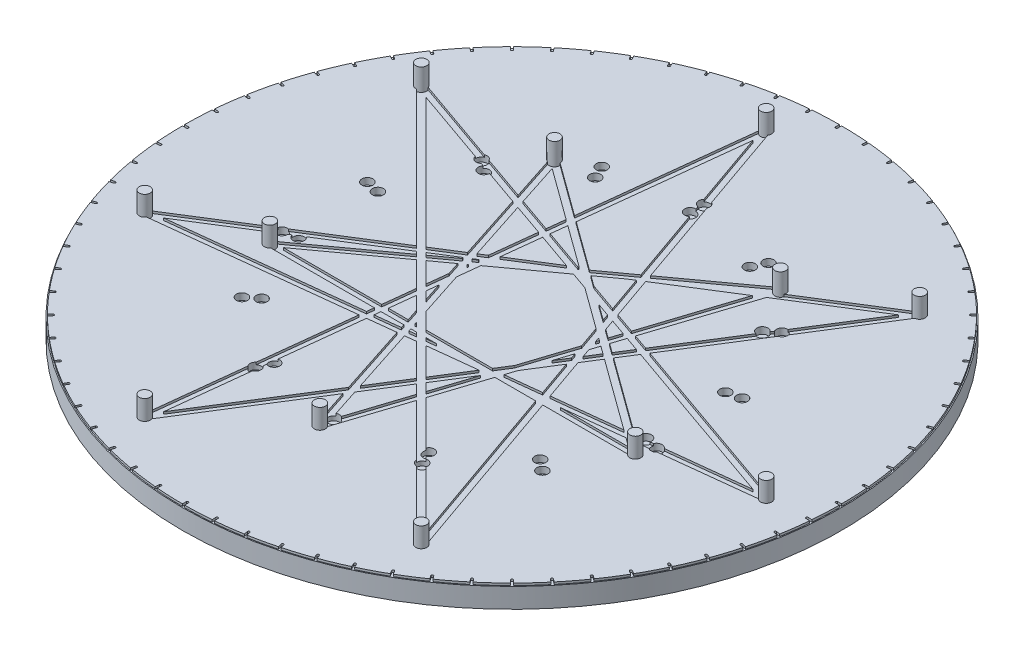
from build123d import *

# Parameters (mm, degrees)
SKETCH1_W              = 300
SKETCH1_H              = 300
BOSS_EXTRUDE2_DEPTH    = 10
CUT_EXTRUDE2_DEPTH     = 1
CUT_EXTRUDE3_START     = -1
CUT_EXTRUDE3_DEPTH     = 1
SKETCH5_R              = 2.5
SKETCH5_R_2            = 2.500000001
BOSS_EXTRUDE3_DEPTH    = 10
SKETCH9_R              = 1.885387977
CUT_EXTRUDE4_DEPTH     = 1
CUT_EXTRUDE5_START     = -1
CUT_EXTRUDE5_OUTLINE_R = 149.65385122
CUT_EXTRUDE5_DEPTH     = 1
CUT_EXTRUDE6_START     = -10
SKETCH11_W             = 362.877518505
SKETCH11_H             = 323.421313856
SKETCH11_R             = 149.65385122
CUT_EXTRUDE6_DEPTH     = 10
SKETCH12_R             = 2.500000001
SKETCH12_R_2           = 2.5
CUT_EXTRUDE7_DEPTH     = 3


# Read off the part's stored shape, not the designer's step: Cut-Extrude3, Cut-Extrude5
with BuildPart() as part:
    # Sketch1 → Boss-Extrude2 (new body)
    with BuildSketch(Plane(origin=(0, 0, 0), x_dir=(1, 0, 0), z_dir=(0, 1, 0))):
        Rectangle(SKETCH1_W, SKETCH1_H)
    extrude(amount=-BOSS_EXTRUDE2_DEPTH)

    # Sketch4 → Cut-Extrude2 (cut)
    with BuildSketch(Plane(origin=(0, 0, 0), x_dir=(1, 0, 0), z_dir=(0, 1, 0))):
        with BuildLine():
            Line((-2.044618763, -85.826412458), (-20.68202698, -28.466368014))
            Line((-20.68202698, -28.466368014), (-80.993946895, -28.466368014))
            ThreePointArc((-80.993946895, -28.466368014), (-85.371588185, -27.7389105), (-82.257590784, -24.577272018))
            Line((-82.257590784, -24.577272018), (-33.464222611, 10.873185046))
            Line((-33.464222611, 10.873185046), (-52.101630828, 68.233229491))
            ThreePointArc((-52.101630828, 68.233229491), (-52.762543171, 72.621410501), (-48.793368173, 70.636823003))
            Line((-48.793368173, 70.636823003), (0, 35.186365939))
            Line((0, 35.186365939), (48.793368175, 70.636823002))
            ThreePointArc((48.793368175, 70.636823002), (52.762543172, 72.6214105), (52.101630827, 68.23322949))
            Line((52.101630827, 68.23322949), (33.464222609, 10.873185045))
            Line((33.464222609, 10.873185045), (82.257590783, -24.577272019))
            ThreePointArc((82.257590783, -24.577272019), (85.371588185, -27.738910499), (80.993946895, -28.466368014))
            Line((80.993946895, -28.466368014), (20.68202698, -28.466368014))
            Line((20.68202698, -28.466368014), (2.044618764, -85.826412459))
            ThreePointArc((2.044618764, -85.826412459), (-1e-09, -89.765000001), (-2.044618763, -85.826412458))
        make_face()
        Polygon((48.439910492, 66.671817031), (30.912270185, 12.727287011), (2.551952425, 33.332263973), align=None, mode=Mode.SUBTRACT)
        Polygon((18.502399396, -25.466368015), (-18.502399397, -25.466368013), (-29.937511097, 9.727287013), (0, 31.478162007), (29.937511096, 9.727287011), align=None, mode=Mode.SUBTRACT)
        Polygon((17.527640307, -28.466368014), (0, -82.410898034), (-17.527640307, -28.466368014), align=None, mode=Mode.SUBTRACT)
        Polygon((-21.656786069, -25.466368013), (-32.489463522, 7.873185046), (-78.377421589, -25.466368011), align=None, mode=Mode.SUBTRACT)
        Polygon((-30.912270186, 12.727287013), (-48.439910493, 66.671817032), (-2.551952425, 33.332263973), align=None, mode=Mode.SUBTRACT)
        Polygon((32.489463521, 7.873185046), (78.377421587, -25.466368015), (21.656786067, -25.466368013), align=None, mode=Mode.SUBTRACT)
    extrude(amount=-CUT_EXTRUDE2_DEPTH, mode=Mode.SUBTRACT)

    # Cut-Extrude3 outline → Cut-Extrude3 (cut)
    # profile 1 of 14: a face of its own
    with BuildSketch(Plane(origin=(0, 0, 0), x_dir=(1, 0, 0), z_dir=(0, 1, 0)).offset(CUT_EXTRUDE3_START)):
        Polygon((32.583002023, 17.869270883), (33.510286464, 20.723158941), (24.037744671, 24.037744671), (17.240776069, 43.462364937), (46.967785818, 62.141083154), (48.414323902, 66.593069603), (47.801725726, 66.208148657), (11.721944825, 39.994653433), (14.6352782, 41.825222119), (20.415928392, 25.305073), (7.268325842, 29.905618107), (15.707326742, 23.774325059), (21.68325672, 21.68325672), (22.739281696, 18.66531073), (27.001120275, 15.568903754), (25.305073, 20.415928392), align=None)
    # profile 2 of 14: a face of its own
    with BuildSketch(Plane(origin=(0, 0, 0), x_dir=(1, 0, 0), z_dir=(0, 1, 0)).offset(CUT_EXTRUDE3_START)):
        Polygon((-3.464629485, 33.995362671), (-3.806176889, 33.780754214), (-23.230797155, 40.577722816), (-22.420677073, 47.767737407), (-25.211221167, 49.795186367), (-26.135268301, 41.594041226), (-42.107611928, 47.183005985), (-40.942425428, 43.596930678), (-26.479799855, 38.536239113), (-28.78396962, 18.086166831), (-31.9974166, 16.067024269), (-31.04138793, 13.124670568), (-29.21359344, 14.273149965), (-29.251845179, 13.933656394), (-2.551952425, 33.332263973), align=None)
        Polygon((-23.575328709, 37.519920703), (-7.055179589, 31.739270511), (-25.53496692, 20.127650534), align=None, mode=Mode.SUBTRACT)
    # profile 3 of 14: a face of its own
    with BuildSketch(Plane(origin=(0, 0, 0), x_dir=(1, 0, 0), z_dir=(0, 1, 0)).offset(CUT_EXTRUDE3_START)):
        with BuildLine():
            Line((-44.501453358, 44.842288413), (-45.666639858, 48.42836372))
            Line((-45.666639858, 48.42836372), (-108.453012425, 70.398265687))
            ThreePointArc((-108.453012425, 70.398265687), (-112.953008177, 70.973079008), (-110.482644288, 67.168125082))
            Line((-110.482644288, 67.168125082), (-48.814604168, 5.500084962))
            Line((-48.814604168, 5.500084962), (-122.658927653, -40.899378758))
            ThreePointArc((-122.658927653, -40.899378758), (-125.914036263, -44.059226865), (-121.398956803, -44.500168573))
            Line((-121.398956803, -44.500168573), (-34.73554746, -34.73554746))
            Line((-34.73554746, -34.73554746), (-44.500168574, -121.398956804))
            ThreePointArc((-44.500168574, -121.398956804), (-44.059226864, -125.914036263), (-40.899378758, -122.658927654))
            Line((-40.899378758, -122.658927654), (-7.399844087, -69.344723641))
            Line((-7.399844087, -69.344723641), (-8.607500356, -65.627939823))
            Line((-8.607500356, -65.627939823), (-41.007138263, -117.191668163))
            Line((-41.007138263, -117.191668163), (-31.677745347, -34.391015906))
            Line((-31.677745347, -34.391015906), (-19.213310863, -32.986611429))
            Line((-19.213310863, -32.986611429), (-20.159594688, -30.074249279))
            Line((-20.159594688, -30.074249279), (-31.333213794, -31.333213793))
            Line((-31.333213794, -31.333213793), (-31.010197851, -28.466368014))
            Line((-31.010197851, -28.466368014), (-34.029180581, -28.466368014))
            Line((-34.029180581, -28.466368014), (-34.391015907, -31.677745347))
            Line((-34.391015907, -31.677745347), (-117.191668163, -41.007138262))
            Line((-117.191668163, -41.007138262), (-46.63873012, 3.324210913))
            Line((-46.63873012, 3.324210913), (-45.467101952, 2.152582746))
            Line((-45.467101952, 2.152582746), (-43.009797473, 3.937918954))
            Line((-43.009797473, 3.937918954), (-44.033232251, 4.961353732))
            Line((-44.033232251, 4.961353732), (-33.660961045, 11.478683687))
            Line((-33.660961045, 11.478683687), (-34.616989716, 14.421037387))
            Line((-34.616989716, 14.421037387), (-46.209106299, 7.13722778))
            Line((-46.209106299, 7.13722778), (-105.128481662, 66.056603143))
            Line((-105.128481662, 66.056603143), (-44.501453358, 44.842288413))
        make_face()
    # profile 4 of 14: a face of its own
    with BuildSketch(Plane(origin=(0, 0, 0), x_dir=(1, 0, 0), z_dir=(0, 1, 0)).offset(CUT_EXTRUDE3_START)):
        with BuildLine():
            Line((87.793714112, 87.793714112), (43.462364937, 17.240776069))
            Line((43.462364937, 17.240776069), (36.342649544, 19.732072235))
            Line((36.342649544, 19.732072235), (35.415365103, 16.878184176))
            Line((35.415365103, 16.878184176), (41.825222119, 14.6352782))
            Line((41.825222119, 14.6352782), (37.581661682, 7.881690453))
            Line((37.581661682, 7.881690453), (40.014222719, 6.114331407))
            Line((40.014222719, 6.114331407), (44.729693265, 13.61895979))
            Line((44.729693265, 13.61895979), (123.378375072, -13.90140424))
            Line((123.378375072, -13.90140424), (75.057213343, -19.345891591))
            Line((75.057213343, -19.345891591), (78.654600242, -21.959546163))
            Line((78.654600242, -21.959546163), (128.257450569, -16.370647189))
            ThreePointArc((128.257450569, -16.370647189), (132.5612088, -14.936061113), (128.684580208, -12.579766802))
            Line((128.684580208, -12.579766802), (46.366836084, 16.224457659))
            Line((46.366836084, 16.224457659), (92.766299803, 90.068781144))
            ThreePointArc((92.766299803, 90.068781144), (94.328044611, 94.32804461), (90.068781144, 92.766299804))
            Line((90.068781144, 92.766299804), (53.696980641, 69.91238283))
            ThreePointArc((53.696980641, 69.91238283), (53.105495546, 68.876906911), (52.101630827, 68.23322949))
            Line((52.101630827, 68.23322949), (50.931382719, 64.631576153))
            Line((50.931382719, 64.631576153), (87.793714112, 87.793714112))
        make_face()
    # profile 5 of 14: a face of its own
    with BuildSketch(Plane(origin=(0, 0, 0), x_dir=(1, 0, 0), z_dir=(0, 1, 0)).offset(CUT_EXTRUDE3_START)):
        with BuildLine():
            Line((13.520915969, 45.009886408), (16.055031253, 46.851028933))
            Line((16.055031253, 46.851028933), (-12.579766803, 128.684580207))
            ThreePointArc((-12.579766803, 128.684580207), (-14.936061112, 132.5612088), (-16.370647188, 128.257450569))
            Line((-16.370647188, 128.257450569), (-24.825021854, 53.222800076))
            Line((-24.825021854, 53.222800076), (-22.03447776, 51.195351115))
            Line((-22.03447776, 51.195351115), (-13.90140424, 123.378375072))
            Line((-13.90140424, 123.378375072), (13.520915969, 45.009886408))
        make_face()
    # profile 6 of 14: a face of its own
    with BuildSketch(Plane(origin=(0, 0, 0), x_dir=(1, 0, 0), z_dir=(0, 1, 0)).offset(CUT_EXTRUDE3_START)):
        Polygon((27.977558926, 3.695174483), (29.507876224, 8.405006838), (28.741004675, 10.596599811), (24.479166096, 13.693006787), align=None)
    # profile 7 of 14: a face of its own
    with BuildSketch(Plane(origin=(0, 0, 0), x_dir=(1, 0, 0), z_dir=(0, 1, 0)).offset(CUT_EXTRUDE3_START)):
        Polygon((18.502399396, -25.466368015), (20.509936224, -19.28780497), (16.627687754, -25.466368015), align=None)
    # profile 8 of 14: a face of its own
    with BuildSketch(Plane(origin=(0, 0, 0), x_dir=(1, 0, 0), z_dir=(0, 1, 0)).offset(CUT_EXTRUDE3_START)):
        Polygon((-2.050805791, 29.988164383), (5.861510981, 27.219525), (0, 31.478162007), align=None)
    # profile 9 of 14: a face of its own
    with BuildSketch(Plane(origin=(0, 0, 0), x_dir=(1, 0, 0), z_dir=(0, 1, 0)).offset(CUT_EXTRUDE3_START)):
        Polygon((-17.848151192, -25.466368013), (-13.605510505, -25.466368013), (-20.859297742, -18.212580777), (-18.817292494, -24.497226713), align=None)
    # profile 10 of 14: a face of its own
    with BuildSketch(Plane(origin=(0, 0, 0), x_dir=(1, 0, 0), z_dir=(0, 1, 0)).offset(CUT_EXTRUDE3_START)):
        Polygon((-27.538660009, 2.344382512), (-26.418755174, 12.283812837), (-29.706911949, 9.894827101), (-29.78030411, 9.243453658), align=None)
    # profile 11 of 14: a face of its own
    with BuildSketch(Plane(origin=(0, 0, 0), x_dir=(1, 0, 0), z_dir=(0, 1, 0)).offset(CUT_EXTRUDE3_START)):
        Polygon((70.638557975, -19.843754482), (40.577722816, -23.230797155), (33.780754214, -3.806176889), (38.414502925, 3.568391938), (35.981941887, 5.335750984), (32.513425885, -0.18436061), (31.143487763, 3.730697614), (29.613170464, -0.979134741), (30.471942183, -3.43336331), (27.042201002, -8.891765131), (23.248104896, -20.568792252), (31.739270511, -7.055179589), (37.519920703, -23.575328708), (21.691758384, -25.35873429), (21.656786067, -25.466368013), (47.530695469, -25.466368014), (74.235944874, -22.457409054), align=None)
    # profile 12 of 14: a face of its own
    with BuildSketch(Plane(origin=(0, 0, 0), x_dir=(1, 0, 0), z_dir=(0, 1, 0)).offset(CUT_EXTRUDE3_START)):
        with BuildLine():
            ThreePointArc((67.168125082, -110.482644288), (70.973079006, -112.953008177), (70.398265688, -108.453012426))
            Line((70.398265688, -108.453012426), (42.409728294, -28.466368014))
            Line((42.409728294, -28.466368014), (39.231369377, -28.466368014))
            Line((39.231369377, -28.466368014), (66.056603143, -105.128481662))
            Line((66.056603143, -105.128481662), (13.009156538, -52.081035057))
            Line((13.009156538, -52.081035057), (11.968702896, -55.283222103))
            Line((11.968702896, -55.283222103), (67.168125082, -110.482644288))
        make_face()
    # profile 13 of 14: a face of its own
    with BuildSketch(Plane(origin=(0, 0, 0), x_dir=(1, 0, 0), z_dir=(0, 1, 0)).offset(CUT_EXTRUDE3_START)):
        Polygon((-30.672179032, -25.466368013), (-29.373575582, -13.940943624), (-23.489902041, -19.824617166), (-25.531907289, -13.53997123), (-28.943951762, -10.127926757), (-28.350862936, -4.864117843), (-30.592507037, 2.034953303), (-31.657222321, -7.414656198), (-40.862034605, 1.790156086), (-43.319339084, 0.004819878), (-32.086846141, -11.227673065), (-33.691161762, -25.466368013), align=None)
    # profile 14 of 14: a face of its own
    with BuildSketch(Plane(origin=(0, 0, 0), x_dir=(1, 0, 0), z_dir=(0, 1, 0)).offset(CUT_EXTRUDE3_START)):
        Polygon((-16.170326794, -32.643749468), (-11.227673065, -32.086846141), (3.324210913, -46.63873012), (-6.52828826, -62.318892729), (-5.320631991, -66.035676547), (5.500084962, -48.814604169), (9.587889416, -52.902408623), (10.628343058, -49.700221577), (7.13722778, -46.209106299), (16.715840119, -30.964832091), (17.527640307, -28.466368014), (-5.889253765, -28.466368014), (-10.127926758, -28.943951761), (-10.605510505, -28.466368014), (-14.848151193, -28.466368014), (-13.940943625, -29.373575582), (-17.116610619, -29.731387318), align=None)
        Polygon((4.961353731, -44.03323225), (-7.414656198, -31.657222321), (14.273149964, -29.213593441), align=None, mode=Mode.SUBTRACT)
    extrude(amount=CUT_EXTRUDE3_DEPTH, mode=Mode.SUBTRACT)

    # Sketch5 → Boss-Extrude3 (add)
    with BuildSketch(Plane(origin=(0, -1, 0), x_dir=(1, 0, 0), z_dir=(0, 1, 0))):
        with Locations(Location((69.642998816, -110.836197679, 0), (0, 0, 72.415816628))):
            Circle(SKETCH5_R)
        with Locations(Location((82.993946894, -26.966368014, 0), (0, 0, 107.130102394))):
            Circle(SKETCH5_R_2)
        with Locations(Location((130.076928275, -14.656149922, 0), (0, 0, 123.844388049))):
            Circle(SKETCH5_R)
        with Locations(Location((51.293080041, 70.598868014, 0), (0, 0, 179.130102334))):
            Circle(SKETCH5_R_2)
        with Locations(Location((92.560277657, 92.560277657, 0), (0, 0, 175.272959483))):
            Circle(SKETCH5_R)
        with Locations(Location((-14.656149922, 130.076928275, 0), (0, 0, 326.15561193))):
            Circle(SKETCH5_R)
        with Locations(Location((-51.293080041, 70.598868014, 0), (0, 0, 0.8698977))):
            Circle(SKETCH5_R_2)
        with Locations(Location((-110.836197679, 69.642998816, 0), (0, 0, 17.584183344))):
            Circle(SKETCH5_R)
        with Locations(Location((-82.993946894, -26.966368014, 0), (0, 0, 72.869897646))):
            Circle(SKETCH5_R_2)
        with Locations(Location((-123.554327937, -43.23352921, 0), (0, 0, 69.012754776))):
            Circle(SKETCH5_R)
        with Locations(Location((-43.23352921, -123.554327937, 0), (0, 0, 120.441326248))):
            Circle(SKETCH5_R)
        with Locations(Location((0, -87.265, 0), (0, 0, 144.869897622))):
            Circle(SKETCH5_R_2)
    extrude(amount=BOSS_EXTRUDE3_DEPTH)

    # Sketch9 → Cut-Extrude4 (cut)
    with BuildSketch(Plane(origin=(0, -1, 0), x_dir=(1, 0, 0), z_dir=(0, 1, 0))):
        with Locations((48.162854768, 65.892863589)):
            Circle(SKETCH9_R)
    extrude(amount=CUT_EXTRUDE4_DEPTH, mode=Mode.SUBTRACT)

    # Cut-Extrude5 outline → Cut-Extrude5 (cut)
    with BuildSketch(Plane(origin=(0, 0, 0), x_dir=(1, 0, 0), z_dir=(0, 1, 0)).offset(CUT_EXTRUDE5_START)):
        Circle(CUT_EXTRUDE5_OUTLINE_R)
        with BuildLine():
            ThreePointArc((25.407745052, -146.97386783), (19.468484255, -147.877819346), (13.497638994, -148.541863039))
            Line((13.497638994, -148.541863039), (13.346134589, -146.810159774))
            ThreePointArc((13.346134589, -146.810159774), (12.804459369, -146.355640296), (12.349939891, -146.897315516))
            Line((12.349939891, -146.897315516), (12.501444296, -148.629018782))
            ThreePointArc((12.501444296, -148.629018782), (6.505999614, -149.011889803), (0.5, -149.153013156))
            Line((0.5, -149.153013156), (0.5, -147.414695065))
            ThreePointArc((0.5, -147.414695065), (0, -146.914695065), (-0.5, -147.414695065))
            Line((-0.5, -147.414695065), (-0.5, -149.153013156))
            ThreePointArc((-0.5, -149.153013156), (-6.505999614, -149.011889803), (-12.501444296, -148.629018782))
            Line((-12.501444296, -148.629018782), (-12.349939891, -146.897315516))
            ThreePointArc((-12.349939891, -146.897315516), (-12.804459369, -146.355640296), (-13.346134589, -146.810159774))
            Line((-13.346134589, -146.810159774), (-13.497638994, -148.541863039))
            ThreePointArc((-13.497638994, -148.541863039), (-19.468484255, -147.877819346), (-25.407745052, -146.97386783))
            Line((-25.407745052, -146.97386783), (-25.105889283, -145.261958697))
            ThreePointArc((-25.105889283, -145.261958697), (-25.511469071, -144.682730732), (-26.090697036, -145.088310519))
            Line((-26.090697036, -145.088310519), (-26.392552805, -146.800219653))
            ThreePointArc((-26.392552805, -146.800219653), (-32.282801975, -145.618309392), (-38.120677526, -144.200156999))
            Line((-38.120677526, -144.200156999), (-37.670767698, -142.521070661))
            ThreePointArc((-37.670767698, -142.521070661), (-38.024321088, -141.908698225), (-38.636693524, -142.262251616))
            Line((-38.636693524, -142.262251616), (-39.086603352, -143.941337954))
            ThreePointArc((-39.086603352, -143.941337954), (-44.85142808, -142.250556177), (-50.543488627, -140.328995903))
            Line((-50.543488627, -140.328995903), (-49.948948824, -138.69551122))
            ThreePointArc((-49.948948824, -138.69551122), (-50.247785063, -138.054654838), (-50.888641445, -138.353491077))
            Line((-50.888641445, -138.353491077), (-51.483181248, -139.986975759))
            ThreePointArc((-51.483181248, -139.986975759), (-57.078707735, -137.800190337), (-62.58163326, -135.389846415))
            Line((-62.58163326, -135.389846415), (-61.84698829, -133.814395192))
            ThreePointArc((-61.84698829, -133.814395192), (-62.088833053, -133.149932168), (-62.753296077, -133.391776931))
            Line((-62.753296077, -133.391776931), (-63.487941047, -134.967228153))
            ThreePointArc((-63.487941047, -134.967228153), (-68.871583959, -132.301081842), (-74.143493876, -129.420298444))
            Line((-74.143493876, -129.420298444), (-73.274334831, -127.914870818))
            ThreePointArc((-73.274334831, -127.914870818), (-73.457347533, -127.231858116), (-74.140360235, -127.414870818))
            Line((-74.140360235, -127.414870818), (-75.00951928, -128.920298444))
            ThreePointArc((-75.00951928, -128.920298444), (-80.140305844, -125.795082229), (-85.141077735, -122.465783857))
            Line((-85.141077735, -122.465783857), (-84.144019439, -121.041837039))
            ThreePointArc((-84.144019439, -121.041837039), (-84.266807244, -120.345472799), (-84.963171484, -120.468260603))
            Line((-84.963171484, -120.468260603), (-85.960229779, -121.892207421))
            ThreePointArc((-85.960229779, -121.892207421), (-90.79911161, -118.331706082), (-95.490686583, -114.579230708))
            Line((-95.490686583, -114.579230708), (-94.373317252, -113.247601794))
            ThreePointArc((-94.373317252, -113.247601794), (-94.434945668, -112.543185767), (-95.139361695, -112.604814184))
            Line((-95.139361695, -112.604814184), (-96.256731026, -113.936443098))
            ThreePointArc((-96.256731026, -113.936443098), (-100.766881312, -109.967754202), (-105.113553647, -105.820660428))
            Line((-105.113553647, -105.820660428), (-103.884377137, -104.591483918))
            ThreePointArc((-103.884377137, -104.591483918), (-103.884377137, -103.884377137), (-104.591483918, -103.884377137))
            Line((-104.591483918, -103.884377137), (-105.820660428, -105.113553647))
            ThreePointArc((-105.820660428, -105.113553647), (-109.967754202, -100.766881312), (-113.936443098, -96.256731026))
            Line((-113.936443098, -96.256731026), (-112.604814184, -95.139361695))
            ThreePointArc((-112.604814184, -95.139361695), (-112.543185767, -94.434945668), (-113.247601794, -94.373317252))
            Line((-113.247601794, -94.373317252), (-114.579230708, -95.490686583))
            ThreePointArc((-114.579230708, -95.490686583), (-118.331706082, -90.79911161), (-121.892207421, -85.960229779))
            Line((-121.892207421, -85.960229779), (-120.468260603, -84.963171484))
            ThreePointArc((-120.468260603, -84.963171484), (-120.345472799, -84.266807244), (-121.041837039, -84.144019439))
            Line((-121.041837039, -84.144019439), (-122.465783857, -85.141077735))
            ThreePointArc((-122.465783857, -85.141077735), (-125.795082229, -80.140305844), (-128.920298444, -75.00951928))
            Line((-128.920298444, -75.00951928), (-127.414870818, -74.140360235))
            ThreePointArc((-127.414870818, -74.140360235), (-127.231858116, -73.457347533), (-127.914870818, -73.274334831))
            Line((-127.914870818, -73.274334831), (-129.420298444, -74.143493876))
            ThreePointArc((-129.420298444, -74.143493876), (-132.301081842, -68.871583959), (-134.967228153, -63.487941047))
            Line((-134.967228153, -63.487941047), (-133.391776931, -62.753296077))
            ThreePointArc((-133.391776931, -62.753296077), (-133.149932168, -62.088833053), (-133.814395192, -61.84698829))
            Line((-133.814395192, -61.84698829), (-135.389846415, -62.58163326))
            ThreePointArc((-135.389846415, -62.58163326), (-137.800190337, -57.078707735), (-139.986975759, -51.483181248))
            Line((-139.986975759, -51.483181248), (-138.353491077, -50.888641445))
            ThreePointArc((-138.353491077, -50.888641445), (-138.054654838, -50.247785063), (-138.69551122, -49.948948824))
            Line((-138.69551122, -49.948948824), (-140.328995903, -50.543488627))
            ThreePointArc((-140.328995903, -50.543488627), (-142.250556177, -44.85142808), (-143.941337954, -39.086603352))
            Line((-143.941337954, -39.086603352), (-142.262251616, -38.636693524))
            ThreePointArc((-142.262251616, -38.636693524), (-141.908698225, -38.024321088), (-142.521070661, -37.670767698))
            Line((-142.521070661, -37.670767698), (-144.200156999, -38.120677526))
            ThreePointArc((-144.200156999, -38.120677526), (-145.618309392, -32.282801975), (-146.800219653, -26.392552805))
            Line((-146.800219653, -26.392552805), (-145.088310519, -26.090697036))
            ThreePointArc((-145.088310519, -26.090697036), (-144.682730732, -25.511469071), (-145.261958697, -25.105889283))
            Line((-145.261958697, -25.105889283), (-146.97386783, -25.407745052))
            ThreePointArc((-146.97386783, -25.407745052), (-147.877819346, -19.468484255), (-148.541863039, -13.497638994))
            Line((-148.541863039, -13.497638994), (-146.810159774, -13.346134589))
            ThreePointArc((-146.810159774, -13.346134589), (-146.355640296, -12.804459369), (-146.897315516, -12.349939891))
            Line((-146.897315516, -12.349939891), (-148.629018782, -12.501444296))
            ThreePointArc((-148.629018782, -12.501444296), (-149.011889803, -6.505999614), (-149.153013156, -0.5))
            Line((-149.153013156, -0.5), (-147.414695065, -0.5))
            ThreePointArc((-147.414695065, -0.5), (-146.914695065, 0), (-147.414695065, 0.5))
            Line((-147.414695065, 0.5), (-149.153013156, 0.5))
            ThreePointArc((-149.153013156, 0.5), (-149.011889803, 6.505999614), (-148.629018782, 12.501444296))
            Line((-148.629018782, 12.501444296), (-146.897315516, 12.349939891))
            ThreePointArc((-146.897315516, 12.349939891), (-146.355640296, 12.804459369), (-146.810159774, 13.346134589))
            Line((-146.810159774, 13.346134589), (-148.541863039, 13.497638994))
            ThreePointArc((-148.541863039, 13.497638994), (-147.877819346, 19.468484255), (-146.97386783, 25.407745052))
            Line((-146.97386783, 25.407745052), (-145.261958697, 25.105889283))
            ThreePointArc((-145.261958697, 25.105889283), (-144.682730732, 25.511469071), (-145.088310519, 26.090697036))
            Line((-145.088310519, 26.090697036), (-146.800219653, 26.392552805))
            ThreePointArc((-146.800219653, 26.392552805), (-145.618309392, 32.282801975), (-144.200156999, 38.120677526))
            Line((-144.200156999, 38.120677526), (-142.521070661, 37.670767698))
            ThreePointArc((-142.521070661, 37.670767698), (-141.908698225, 38.024321088), (-142.262251616, 38.636693524))
            Line((-142.262251616, 38.636693524), (-143.941337954, 39.086603352))
            ThreePointArc((-143.941337954, 39.086603352), (-142.250556177, 44.85142808), (-140.328995903, 50.543488627))
            Line((-140.328995903, 50.543488627), (-138.69551122, 49.948948824))
            ThreePointArc((-138.69551122, 49.948948824), (-138.054654838, 50.247785063), (-138.353491077, 50.888641445))
            Line((-138.353491077, 50.888641445), (-139.986975759, 51.483181248))
            ThreePointArc((-139.986975759, 51.483181248), (-137.800190337, 57.078707735), (-135.389846414, 62.58163326))
            Line((-135.389846414, 62.58163326), (-133.814395192, 61.84698829))
            ThreePointArc((-133.814395192, 61.84698829), (-133.149932168, 62.088833053), (-133.391776931, 62.753296077))
            Line((-133.391776931, 62.753296077), (-134.967228153, 63.487941047))
            ThreePointArc((-134.967228153, 63.487941047), (-132.301081842, 68.871583959), (-129.420298444, 74.143493876))
            Line((-129.420298444, 74.143493876), (-127.914870818, 73.274334831))
            ThreePointArc((-127.914870818, 73.274334831), (-127.231858116, 73.457347533), (-127.414870818, 74.140360235))
            Line((-127.414870818, 74.140360235), (-128.920298444, 75.00951928))
            ThreePointArc((-128.920298444, 75.00951928), (-125.795082229, 80.140305844), (-122.465783857, 85.141077735))
            Line((-122.465783857, 85.141077735), (-121.041837039, 84.144019439))
            ThreePointArc((-121.041837039, 84.144019439), (-120.345472799, 84.266807244), (-120.468260603, 84.963171484))
            Line((-120.468260603, 84.963171484), (-121.892207421, 85.960229779))
            ThreePointArc((-121.892207421, 85.960229779), (-118.331706082, 90.79911161), (-114.579230708, 95.490686583))
            Line((-114.579230708, 95.490686583), (-113.247601794, 94.373317252))
            ThreePointArc((-113.247601794, 94.373317252), (-112.543185767, 94.434945668), (-112.604814184, 95.139361695))
            Line((-112.604814184, 95.139361695), (-113.936443098, 96.256731026))
            ThreePointArc((-113.936443098, 96.256731026), (-109.967754202, 100.766881312), (-105.820660428, 105.113553647))
            Line((-105.820660428, 105.113553647), (-104.591483918, 103.884377137))
            ThreePointArc((-104.591483918, 103.884377137), (-103.884377137, 103.884377137), (-103.884377137, 104.591483918))
            Line((-103.884377137, 104.591483918), (-105.113553647, 105.820660428))
            ThreePointArc((-105.113553647, 105.820660428), (-100.766881312, 109.967754202), (-96.256731026, 113.936443098))
            Line((-96.256731026, 113.936443098), (-95.139361695, 112.604814184))
            ThreePointArc((-95.139361695, 112.604814184), (-94.434945668, 112.543185767), (-94.373317252, 113.247601794))
            Line((-94.373317252, 113.247601794), (-95.490686583, 114.579230708))
            ThreePointArc((-95.490686583, 114.579230708), (-90.79911161, 118.331706082), (-85.960229779, 121.892207421))
            Line((-85.960229779, 121.892207421), (-84.963171484, 120.468260603))
            ThreePointArc((-84.963171484, 120.468260603), (-84.266807244, 120.345472799), (-84.144019439, 121.041837039))
            Line((-84.144019439, 121.041837039), (-85.141077735, 122.465783857))
            ThreePointArc((-85.141077735, 122.465783857), (-80.140305844, 125.795082229), (-75.00951928, 128.920298444))
            Line((-75.00951928, 128.920298444), (-74.140360235, 127.414870818))
            ThreePointArc((-74.140360235, 127.414870818), (-73.457347533, 127.231858116), (-73.274334831, 127.914870818))
            Line((-73.274334831, 127.914870818), (-74.143493876, 129.420298444))
            ThreePointArc((-74.143493876, 129.420298444), (-68.871583959, 132.301081842), (-63.487941047, 134.967228153))
            Line((-63.487941047, 134.967228153), (-62.753296077, 133.391776931))
            ThreePointArc((-62.753296077, 133.391776931), (-62.088833053, 133.149932168), (-61.84698829, 133.814395192))
            Line((-61.84698829, 133.814395192), (-62.58163326, 135.389846415))
            ThreePointArc((-62.58163326, 135.389846415), (-57.078707735, 137.800190337), (-51.483181248, 139.986975759))
            Line((-51.483181248, 139.986975759), (-50.888641445, 138.353491077))
            ThreePointArc((-50.888641445, 138.353491077), (-50.247785063, 138.054654838), (-49.948948824, 138.69551122))
            Line((-49.948948824, 138.69551122), (-50.543488627, 140.328995903))
            ThreePointArc((-50.543488627, 140.328995903), (-44.85142808, 142.250556177), (-39.086603352, 143.941337954))
            Line((-39.086603352, 143.941337954), (-38.636693524, 142.262251616))
            ThreePointArc((-38.636693524, 142.262251616), (-38.024321088, 141.908698225), (-37.670767698, 142.521070661))
            Line((-37.670767698, 142.521070661), (-38.120677526, 144.200156999))
            ThreePointArc((-38.120677526, 144.200156999), (-32.282801975, 145.618309392), (-26.392552805, 146.800219653))
            Line((-26.392552805, 146.800219653), (-26.090697036, 145.088310519))
            ThreePointArc((-26.090697036, 145.088310519), (-25.511469071, 144.682730732), (-25.105889283, 145.261958697))
            Line((-25.105889283, 145.261958697), (-25.407745052, 146.97386783))
            ThreePointArc((-25.407745052, 146.97386783), (-19.468484255, 147.877819346), (-13.497638994, 148.541863039))
            Line((-13.497638994, 148.541863039), (-13.346134589, 146.810159774))
            ThreePointArc((-13.346134589, 146.810159774), (-12.804459369, 146.355640296), (-12.349939891, 146.897315516))
            Line((-12.349939891, 146.897315516), (-12.501444296, 148.629018782))
            ThreePointArc((-12.501444296, 148.629018782), (-6.505999614, 149.011889803), (-0.5, 149.153013156))
            Line((-0.5, 149.153013156), (-0.5, 147.414695065))
            ThreePointArc((-0.5, 147.414695065), (0, 146.914695065), (0.5, 147.414695065))
            Line((0.5, 147.414695065), (0.5, 149.153013156))
            ThreePointArc((0.5, 149.153013156), (6.505999614, 149.011889803), (12.501444296, 148.629018782))
            Line((12.501444296, 148.629018782), (12.349939891, 146.897315516))
            ThreePointArc((12.349939891, 146.897315516), (12.804459369, 146.355640296), (13.346134589, 146.810159774))
            Line((13.346134589, 146.810159774), (13.497638994, 148.541863039))
            ThreePointArc((13.497638994, 148.541863039), (19.468484255, 147.877819346), (25.407745052, 146.97386783))
            Line((25.407745052, 146.97386783), (25.105889283, 145.261958697))
            ThreePointArc((25.105889283, 145.261958697), (25.511469071, 144.682730732), (26.090697036, 145.088310519))
            Line((26.090697036, 145.088310519), (26.392552805, 146.800219653))
            ThreePointArc((26.392552805, 146.800219653), (32.282801975, 145.618309392), (38.120677526, 144.200156999))
            Line((38.120677526, 144.200156999), (37.670767698, 142.521070661))
            ThreePointArc((37.670767698, 142.521070661), (38.024321088, 141.908698225), (38.636693524, 142.262251616))
            Line((38.636693524, 142.262251616), (39.086603352, 143.941337954))
            ThreePointArc((39.086603352, 143.941337954), (44.85142808, 142.250556177), (50.543488627, 140.328995903))
            Line((50.543488627, 140.328995903), (49.948948824, 138.69551122))
            ThreePointArc((49.948948824, 138.69551122), (50.247785063, 138.054654838), (50.888641445, 138.353491077))
            Line((50.888641445, 138.353491077), (51.483181248, 139.986975759))
            ThreePointArc((51.483181248, 139.986975759), (57.078707735, 137.800190337), (62.58163326, 135.389846414))
            Line((62.58163326, 135.389846414), (61.84698829, 133.814395192))
            ThreePointArc((61.84698829, 133.814395192), (62.088833053, 133.149932168), (62.753296077, 133.391776931))
            Line((62.753296077, 133.391776931), (63.487941047, 134.967228153))
            ThreePointArc((63.487941047, 134.967228153), (68.871583959, 132.301081842), (74.143493876, 129.420298444))
            Line((74.143493876, 129.420298444), (73.274334831, 127.914870818))
            ThreePointArc((73.274334831, 127.914870818), (73.457347533, 127.231858116), (74.140360235, 127.414870818))
            Line((74.140360235, 127.414870818), (75.00951928, 128.920298444))
            ThreePointArc((75.00951928, 128.920298444), (80.140305844, 125.795082229), (85.141077735, 122.465783857))
            Line((85.141077735, 122.465783857), (84.144019439, 121.041837039))
            ThreePointArc((84.144019439, 121.041837039), (84.266807244, 120.345472799), (84.963171484, 120.468260603))
            Line((84.963171484, 120.468260603), (85.960229779, 121.892207421))
            ThreePointArc((85.960229779, 121.892207421), (90.79911161, 118.331706082), (95.490686583, 114.579230708))
            Line((95.490686583, 114.579230708), (94.373317252, 113.247601794))
            ThreePointArc((94.373317252, 113.247601794), (94.434945668, 112.543185767), (95.139361695, 112.604814184))
            Line((95.139361695, 112.604814184), (96.256731026, 113.936443098))
            ThreePointArc((96.256731026, 113.936443098), (100.766881312, 109.967754202), (105.113553647, 105.820660428))
            Line((105.113553647, 105.820660428), (103.884377137, 104.591483918))
            ThreePointArc((103.884377137, 104.591483918), (103.884377137, 103.884377137), (104.591483918, 103.884377137))
            Line((104.591483918, 103.884377137), (105.820660428, 105.113553647))
            ThreePointArc((105.820660428, 105.113553647), (109.967754202, 100.766881312), (113.936443098, 96.256731026))
            Line((113.936443098, 96.256731026), (112.604814184, 95.139361695))
            ThreePointArc((112.604814184, 95.139361695), (112.543185767, 94.434945668), (113.247601794, 94.373317252))
            Line((113.247601794, 94.373317252), (114.579230708, 95.490686583))
            ThreePointArc((114.579230708, 95.490686583), (118.331706082, 90.79911161), (121.892207421, 85.960229779))
            Line((121.892207421, 85.960229779), (120.468260603, 84.963171484))
            ThreePointArc((120.468260603, 84.963171484), (120.345472799, 84.266807244), (121.041837039, 84.144019439))
            Line((121.041837039, 84.144019439), (122.465783857, 85.141077735))
            ThreePointArc((122.465783857, 85.141077735), (125.795082229, 80.140305844), (128.920298444, 75.00951928))
            Line((128.920298444, 75.00951928), (127.414870818, 74.140360235))
            ThreePointArc((127.414870818, 74.140360235), (127.231858116, 73.457347533), (127.914870818, 73.274334831))
            Line((127.914870818, 73.274334831), (129.420298444, 74.143493876))
            ThreePointArc((129.420298444, 74.143493876), (132.301081842, 68.871583959), (134.967228153, 63.487941047))
            Line((134.967228153, 63.487941047), (133.391776931, 62.753296077))
            ThreePointArc((133.391776931, 62.753296077), (133.149932168, 62.088833053), (133.814395192, 61.84698829))
            Line((133.814395192, 61.84698829), (135.389846415, 62.58163326))
            ThreePointArc((135.389846415, 62.58163326), (137.800190337, 57.078707735), (139.986975759, 51.483181248))
            Line((139.986975759, 51.483181248), (138.353491077, 50.888641445))
            ThreePointArc((138.353491077, 50.888641445), (138.054654838, 50.247785063), (138.69551122, 49.948948824))
            Line((138.69551122, 49.948948824), (140.328995903, 50.543488627))
            ThreePointArc((140.328995903, 50.543488627), (142.250556177, 44.85142808), (143.941337954, 39.086603352))
            Line((143.941337954, 39.086603352), (142.262251616, 38.636693524))
            ThreePointArc((142.262251616, 38.636693524), (141.908698225, 38.024321088), (142.521070661, 37.670767698))
            Line((142.521070661, 37.670767698), (144.200156999, 38.120677526))
            ThreePointArc((144.200156999, 38.120677526), (145.618309392, 32.282801975), (146.800219653, 26.392552805))
            Line((146.800219653, 26.392552805), (145.088310519, 26.090697036))
            ThreePointArc((145.088310519, 26.090697036), (144.682730732, 25.511469071), (145.261958697, 25.105889283))
            Line((145.261958697, 25.105889283), (146.97386783, 25.407745052))
            ThreePointArc((146.97386783, 25.407745052), (147.877819346, 19.468484255), (148.541863039, 13.497638994))
            Line((148.541863039, 13.497638994), (146.810159774, 13.346134589))
            ThreePointArc((146.810159774, 13.346134589), (146.355640296, 12.804459369), (146.897315516, 12.349939891))
            Line((146.897315516, 12.349939891), (148.629018782, 12.501444296))
            ThreePointArc((148.629018782, 12.501444296), (149.011889803, 6.505999614), (149.153013156, 0.5))
            Line((149.153013156, 0.5), (147.414695065, 0.5))
            ThreePointArc((147.414695065, 0.5), (146.914695065, 0), (147.414695065, -0.5))
            Line((147.414695065, -0.5), (149.153013156, -0.5))
            ThreePointArc((149.153013156, -0.5), (149.011889803, -6.505999614), (148.629018782, -12.501444296))
            Line((148.629018782, -12.501444296), (146.897315516, -12.349939891))
            ThreePointArc((146.897315516, -12.349939891), (146.355640296, -12.804459369), (146.810159774, -13.346134589))
            Line((146.810159774, -13.346134589), (148.541863039, -13.497638994))
            ThreePointArc((148.541863039, -13.497638994), (147.877819346, -19.468484255), (146.97386783, -25.407745052))
            Line((146.97386783, -25.407745052), (145.261958697, -25.105889283))
            ThreePointArc((145.261958697, -25.105889283), (144.682730732, -25.511469071), (145.088310519, -26.090697036))
            Line((145.088310519, -26.090697036), (146.800219653, -26.392552805))
            ThreePointArc((146.800219653, -26.392552805), (145.618309392, -32.282801975), (144.200156999, -38.120677526))
            Line((144.200156999, -38.120677526), (142.521070661, -37.670767698))
            ThreePointArc((142.521070661, -37.670767698), (141.908698225, -38.024321088), (142.262251616, -38.636693524))
            Line((142.262251616, -38.636693524), (143.941337954, -39.086603352))
            ThreePointArc((143.941337954, -39.086603352), (142.250556177, -44.85142808), (140.328995903, -50.543488627))
            Line((140.328995903, -50.543488627), (138.69551122, -49.948948824))
            ThreePointArc((138.69551122, -49.948948824), (138.054654838, -50.247785063), (138.353491077, -50.888641445))
            Line((138.353491077, -50.888641445), (139.986975759, -51.483181248))
            ThreePointArc((139.986975759, -51.483181248), (137.800190337, -57.078707735), (135.389846414, -62.58163326))
            Line((135.389846414, -62.58163326), (133.814395192, -61.84698829))
            ThreePointArc((133.814395192, -61.84698829), (133.149932168, -62.088833053), (133.391776931, -62.753296077))
            Line((133.391776931, -62.753296077), (134.967228153, -63.487941047))
            ThreePointArc((134.967228153, -63.487941047), (132.301081842, -68.871583959), (129.420298444, -74.143493876))
            Line((129.420298444, -74.143493876), (127.914870818, -73.274334831))
            ThreePointArc((127.914870818, -73.274334831), (127.231858116, -73.457347533), (127.414870818, -74.140360235))
            Line((127.414870818, -74.140360235), (128.920298444, -75.00951928))
            ThreePointArc((128.920298444, -75.00951928), (125.795082229, -80.140305844), (122.465783857, -85.141077735))
            Line((122.465783857, -85.141077735), (121.041837039, -84.144019439))
            ThreePointArc((121.041837039, -84.144019439), (120.345472799, -84.266807244), (120.468260603, -84.963171484))
            Line((120.468260603, -84.963171484), (121.892207421, -85.960229779))
            ThreePointArc((121.892207421, -85.960229779), (118.331706082, -90.79911161), (114.579230708, -95.490686583))
            Line((114.579230708, -95.490686583), (113.247601794, -94.373317252))
            ThreePointArc((113.247601794, -94.373317252), (112.543185767, -94.434945668), (112.604814184, -95.139361695))
            Line((112.604814184, -95.139361695), (113.936443098, -96.256731026))
            ThreePointArc((113.936443098, -96.256731026), (109.967754202, -100.766881312), (105.820660428, -105.113553647))
            Line((105.820660428, -105.113553647), (104.591483918, -103.884377137))
            ThreePointArc((104.591483918, -103.884377137), (103.884377137, -103.884377137), (103.884377137, -104.591483918))
            Line((103.884377137, -104.591483918), (105.113553647, -105.820660428))
            ThreePointArc((105.113553647, -105.820660428), (100.766881312, -109.967754202), (96.256731026, -113.936443098))
            Line((96.256731026, -113.936443098), (95.139361695, -112.604814184))
            ThreePointArc((95.139361695, -112.604814184), (94.434945668, -112.543185767), (94.373317252, -113.247601794))
            Line((94.373317252, -113.247601794), (95.490686583, -114.579230708))
            ThreePointArc((95.490686583, -114.579230708), (90.79911161, -118.331706082), (85.960229779, -121.892207421))
            Line((85.960229779, -121.892207421), (84.963171484, -120.468260603))
            ThreePointArc((84.963171484, -120.468260603), (84.266807244, -120.345472799), (84.144019439, -121.041837039))
            Line((84.144019439, -121.041837039), (85.141077735, -122.465783857))
            ThreePointArc((85.141077735, -122.465783857), (80.140305844, -125.795082229), (75.00951928, -128.920298444))
            Line((75.00951928, -128.920298444), (74.140360235, -127.414870818))
            ThreePointArc((74.140360235, -127.414870818), (73.457347533, -127.231858116), (73.274334831, -127.914870818))
            Line((73.274334831, -127.914870818), (74.143493876, -129.420298444))
            ThreePointArc((74.143493876, -129.420298444), (68.871583959, -132.301081842), (63.487941047, -134.967228153))
            Line((63.487941047, -134.967228153), (62.753296077, -133.391776931))
            ThreePointArc((62.753296077, -133.391776931), (62.088833053, -133.149932168), (61.84698829, -133.814395192))
            Line((61.84698829, -133.814395192), (62.58163326, -135.389846415))
            ThreePointArc((62.58163326, -135.389846415), (57.078707735, -137.800190337), (51.483181248, -139.986975759))
            Line((51.483181248, -139.986975759), (50.888641445, -138.353491077))
            ThreePointArc((50.888641445, -138.353491077), (50.247785063, -138.054654838), (49.948948824, -138.69551122))
            Line((49.948948824, -138.69551122), (50.543488627, -140.328995903))
            ThreePointArc((50.543488627, -140.328995903), (44.85142808, -142.250556177), (39.086603352, -143.941337954))
            Line((39.086603352, -143.941337954), (38.636693524, -142.262251616))
            ThreePointArc((38.636693524, -142.262251616), (38.024321088, -141.908698225), (37.670767698, -142.521070661))
            Line((37.670767698, -142.521070661), (38.120677526, -144.200156999))
            ThreePointArc((38.120677526, -144.200156999), (32.282801975, -145.618309392), (26.392552805, -146.800219653))
            Line((26.392552805, -146.800219653), (26.090697036, -145.088310519))
            ThreePointArc((26.090697036, -145.088310519), (25.511469071, -144.682730732), (25.105889283, -145.261958697))
            Line((25.105889283, -145.261958697), (25.407745052, -146.97386783))
        make_face(mode=Mode.SUBTRACT)
    extrude(amount=CUT_EXTRUDE5_DEPTH, mode=Mode.SUBTRACT)

    # Sketch11 → Cut-Extrude6 (cut)
    with BuildSketch(Plane(origin=(0, 0, 0), x_dir=(1, 0, 0), z_dir=(0, 1, 0)).offset(CUT_EXTRUDE6_START)):
        with Locations((15.215508046, 0.430910876)):
            Rectangle(SKETCH11_W, SKETCH11_H)
        with Locations(Location((0, 0, 0), (0, 0, 270))):
            Circle(SKETCH11_R, mode=Mode.SUBTRACT)
    extrude(amount=CUT_EXTRUDE6_DEPTH, mode=Mode.SUBTRACT)

    # Sketch12 → Cut-Extrude7 (cut)
    with BuildSketch(Plane(origin=(0, 0, 0), x_dir=(1, 0, 0), z_dir=(0, 1, 0))):
        with Locations(Location((-37.862864494, -78.623048258, 0), (0, 0, 270))):
            Circle(SKETCH12_R)
        with Locations(Location((-68.226524318, -54.408837559, 0), (0, 0, 270))):
            Circle(SKETCH12_R)
        with Locations(Location((-85.077084257, -19.418289302, 0), (0, 0, 270))):
            Circle(SKETCH12_R)
        with Locations(Location((-85.077084257, 19.418289302, 0), (0, 0, 270))):
            Circle(SKETCH12_R)
        with Locations(Location((-68.226524318, 54.408837559, 0), (0, 0, 270))):
            Circle(SKETCH12_R)
        with Locations(Location((-37.862864494, 78.623048258, 0), (0, 0, 270))):
            Circle(SKETCH12_R)
        with Locations(Location((0, 87.265, 0), (0, 0, 270))):
            Circle(SKETCH12_R)
        with Locations(Location((37.862864494, 78.623048258, 0), (0, 0, 270))):
            Circle(SKETCH12_R)
        with Locations(Location((68.226524318, 54.408837559, 0), (0, 0, 270))):
            Circle(SKETCH12_R)
        with Locations(Location((85.077084257, 19.418289302, 0), (0, 0, 270))):
            Circle(SKETCH12_R)
        with Locations(Location((85.077084257, -19.418289302, 0), (0, 0, 270))):
            Circle(SKETCH12_R)
        with Locations(Location((68.226524318, -54.408837559, 0), (0, 0, 270))):
            Circle(SKETCH12_R)
        with Locations(Location((37.862864494, -78.623048258, 0), (0, 0, 270))):
            Circle(SKETCH12_R)
        with Locations(Location((0, -80.9, 0), (0, 0, 270))):
            Circle(SKETCH12_R_2)
        with Locations(Location((-35.101194495, -72.888381413, 0), (0, 0, 270))):
            Circle(SKETCH12_R_2)
        with Locations(Location((-63.250166932, -50.44032497, 0), (0, 0, 270))):
            Circle(SKETCH12_R_2)
        with Locations(Location((-78.871668096, -18.001943557, 0), (0, 0, 270))):
            Circle(SKETCH12_R_2)
        with Locations(Location((-78.871668096, 18.001943557, 0), (0, 0, 270))):
            Circle(SKETCH12_R_2)
        with Locations(Location((-63.250166932, 50.44032497, 0), (0, 0, 270))):
            Circle(SKETCH12_R_2)
        with Locations(Location((-35.101194495, 72.888381413, 0), (0, 0, 270))):
            Circle(SKETCH12_R_2)
        with Locations(Location((0, 80.9, 0), (0, 0, 270))):
            Circle(SKETCH12_R_2)
        with Locations(Location((35.101194495, 72.888381413, 0), (0, 0, 270))):
            Circle(SKETCH12_R_2)
        with Locations(Location((63.250166932, 50.44032497, 0), (0, 0, 270))):
            Circle(SKETCH12_R_2)
        with Locations(Location((78.871668096, 18.001943557, 0), (0, 0, 270))):
            Circle(SKETCH12_R_2)
        with Locations(Location((78.871668096, -18.001943557, 0), (0, 0, 270))):
            Circle(SKETCH12_R_2)
        with Locations(Location((63.250166932, -50.44032497, 0), (0, 0, 270))):
            Circle(SKETCH12_R_2)
        with Locations(Location((35.101194495, -72.888381413, 0), (0, 0, 270))):
            Circle(SKETCH12_R_2)
    extrude(amount=-CUT_EXTRUDE7_DEPTH, mode=Mode.SUBTRACT)


solid = part.part
